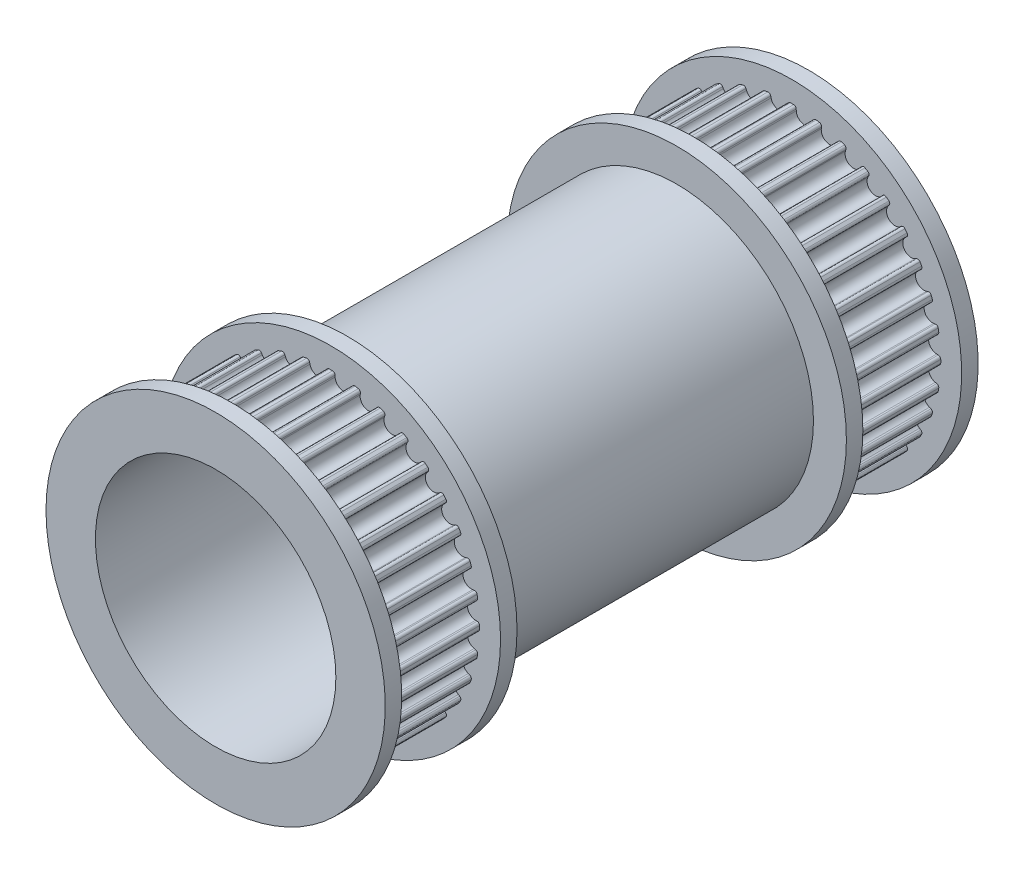
from build123d import *

# Parameters (mm, degrees)
SKETCH2_R             = 45.15
EXTRUDE1_DEPTH        = 30
EXTRUDE2_DEPTH        = 140
CIRPATTERN1_COUNT     = 36
SKETCH6_R             = 41.5
EXTRUDE6_DEPTH        = 110
MIRROR4_COPY_1_DEPTH  = 140
MIRROR4_COPY_2_DEPTH  = 140
MIRROR4_COPY_3_DEPTH  = 140
MIRROR4_COPY_4_DEPTH  = 140
MIRROR4_COPY_5_DEPTH  = 140
MIRROR4_COPY_6_DEPTH  = 140
MIRROR4_COPY_7_DEPTH  = 140
MIRROR4_COPY_8_DEPTH  = 140
MIRROR4_COPY_9_DEPTH  = 140
MIRROR4_COPY_10_DEPTH = 140
MIRROR4_COPY_11_DEPTH = 140
MIRROR4_COPY_12_DEPTH = 140
MIRROR4_COPY_13_DEPTH = 140
MIRROR4_COPY_14_DEPTH = 140
MIRROR4_COPY_15_DEPTH = 140
MIRROR4_COPY_16_DEPTH = 140
MIRROR4_COPY_17_DEPTH = 140
MIRROR4_COPY_18_DEPTH = 140
MIRROR4_COPY_19_DEPTH = 140
MIRROR4_COPY_20_DEPTH = 140
MIRROR4_COPY_21_DEPTH = 140
MIRROR4_COPY_22_DEPTH = 140
MIRROR4_COPY_23_DEPTH = 140
MIRROR4_COPY_24_DEPTH = 140
MIRROR4_COPY_25_DEPTH = 140
MIRROR4_COPY_26_DEPTH = 140
MIRROR4_COPY_27_DEPTH = 140
MIRROR4_COPY_28_DEPTH = 140
MIRROR4_COPY_29_DEPTH = 140
MIRROR4_COPY_30_DEPTH = 140
MIRROR4_COPY_31_DEPTH = 140
MIRROR4_COPY_32_DEPTH = 140
MIRROR4_COPY_33_DEPTH = 140
MIRROR4_COPY_34_DEPTH = 140
MIRROR4_COPY_35_DEPTH = 140
SKETCH7_R             = 51.5
SKETCH7_R_2           = 41.5
EXTRUDE7_DEPTH        = 5
EXTRUDE8_START        = 5
SKETCH8_R             = 51.5
EXTRUDE8_DEPTH        = 5
EXTRUDE9_DEPTH        = 116.777804436
EXTRUDE9_DEPTH_BACK   = 116.777804436
SKETCH9_R             = 36.5


with BuildPart() as part:
    # Sketch2 → Extrude1 (new body)
    with BuildSketch(Plane.XY):
        Circle(SKETCH2_R)
    extrude1 = extrude(amount=EXTRUDE1_DEPTH)

    # Sketch1 → Extrude2 (cut)
    with BuildSketch(Plane.XY):
        with BuildLine():
            Line((-1.265610805, 44.394558923), (-1.282106289, 43.922190055))
            ThreePointArc((-1.282106289, 43.922190055), (-3.626550456, 41.451661388), (-6.364380048, 43.477548716))
            Line((-6.364380048, 43.477548716), (-6.462650922, 43.939876828))
            ThreePointArc((-6.462650922, 43.939876828), (-6.785899963, 44.421956093), (-7.352628199, 44.547293504))
            ThreePointArc((-7.352628199, 44.547293504), (-3.935081785, 44.978190619), (-0.494631081, 45.147290507))
            ThreePointArc((-0.494631081, 45.147290507), (-1.030984829, 44.925445927), (-1.265610805, 44.394558923))
        make_face()
    extrude2 = extrude(amount=EXTRUDE2_DEPTH, mode=Mode.SUBTRACT)

    # CirPattern1: Extrude2 ×36 about axis
    cirpattern1_axis = Axis((0, 0, 0), (0, 0, 1))
    for i in range(1, CIRPATTERN1_COUNT):
        add(extrude2.rotate(cirpattern1_axis, i * 360 / CIRPATTERN1_COUNT), mode=Mode.SUBTRACT)

    # Sketch6 → Extrude6 (add)
    with BuildSketch(Plane.XY.offset(30)):
        Circle(SKETCH6_R)
    extrude(amount=EXTRUDE6_DEPTH)

    # Mirror4: Extrude1, Extrude2 across plane
    add(extrude1.mirror(Plane.XY.offset(85)))
    add(extrude2.mirror(Plane.XY.offset(85)), mode=Mode.SUBTRACT)

    # Mirror4 copy 1 sketch → Mirror4 copy 1 (cut)
    with BuildSketch(Plane(origin=(0, 0, 170), x_dir=(0.984807753012208, 0.17364817766693033, 0), z_dir=(0, 0, -1))):
        with BuildLine():
            Line((-1.265610805, -44.394558923), (-1.282106289, -43.922190055))
            ThreePointArc((-1.282106289, -43.922190055), (-3.626550456, -41.451661388), (-6.364380048, -43.477548716))
            Line((-6.364380048, -43.477548716), (-6.462650922, -43.939876828))
            ThreePointArc((-6.462650922, -43.939876828), (-6.785899963, -44.421956093), (-7.352628199, -44.547293504))
            ThreePointArc((-7.352628199, -44.547293504), (-3.935081785, -44.978190619), (-0.494631081, -45.147290507))
            ThreePointArc((-0.494631081, -45.147290507), (-1.030984829, -44.925445927), (-1.265610805, -44.394558923))
        make_face()
    extrude(amount=MIRROR4_COPY_1_DEPTH, mode=Mode.SUBTRACT)

    # Mirror4 copy 2 sketch → Mirror4 copy 2 (cut)
    with BuildSketch(Plane(origin=(0, 0, 170), x_dir=(0.9396926207859084, 0.3420201433256687, 0), z_dir=(0, 0, -1))):
        with BuildLine():
            Line((-1.265610805, -44.394558923), (-1.282106289, -43.922190055))
            ThreePointArc((-1.282106289, -43.922190055), (-3.626550456, -41.451661388), (-6.364380048, -43.477548716))
            Line((-6.364380048, -43.477548716), (-6.462650922, -43.939876828))
            ThreePointArc((-6.462650922, -43.939876828), (-6.785899963, -44.421956093), (-7.352628199, -44.547293504))
            ThreePointArc((-7.352628199, -44.547293504), (-3.935081785, -44.978190619), (-0.494631081, -45.147290507))
            ThreePointArc((-0.494631081, -45.147290507), (-1.030984829, -44.925445927), (-1.265610805, -44.394558923))
        make_face()
    extrude(amount=MIRROR4_COPY_2_DEPTH, mode=Mode.SUBTRACT)

    # Mirror4 copy 3 sketch → Mirror4 copy 3 (cut)
    with BuildSketch(Plane(origin=(0, 0, 170), x_dir=(0.8660254037844387, 0.49999999999999994, 0), z_dir=(0, 0, -1))):
        with BuildLine():
            Line((-1.265610805, -44.394558923), (-1.282106289, -43.922190055))
            ThreePointArc((-1.282106289, -43.922190055), (-3.626550456, -41.451661388), (-6.364380048, -43.477548716))
            Line((-6.364380048, -43.477548716), (-6.462650922, -43.939876828))
            ThreePointArc((-6.462650922, -43.939876828), (-6.785899963, -44.421956093), (-7.352628199, -44.547293504))
            ThreePointArc((-7.352628199, -44.547293504), (-3.935081785, -44.978190619), (-0.494631081, -45.147290507))
            ThreePointArc((-0.494631081, -45.147290507), (-1.030984829, -44.925445927), (-1.265610805, -44.394558923))
        make_face()
    extrude(amount=MIRROR4_COPY_3_DEPTH, mode=Mode.SUBTRACT)

    # Mirror4 copy 4 sketch → Mirror4 copy 4 (cut)
    with BuildSketch(Plane(origin=(0, 0, 170), x_dir=(0.766044443118978, 0.6427876096865393, 0), z_dir=(0, 0, -1))):
        with BuildLine():
            Line((-1.265610805, -44.394558923), (-1.282106289, -43.922190055))
            ThreePointArc((-1.282106289, -43.922190055), (-3.626550456, -41.451661388), (-6.364380048, -43.477548716))
            Line((-6.364380048, -43.477548716), (-6.462650922, -43.939876828))
            ThreePointArc((-6.462650922, -43.939876828), (-6.785899963, -44.421956093), (-7.352628199, -44.547293504))
            ThreePointArc((-7.352628199, -44.547293504), (-3.935081785, -44.978190619), (-0.494631081, -45.147290507))
            ThreePointArc((-0.494631081, -45.147290507), (-1.030984829, -44.925445927), (-1.265610805, -44.394558923))
        make_face()
    extrude(amount=MIRROR4_COPY_4_DEPTH, mode=Mode.SUBTRACT)

    # Mirror4 copy 5 sketch → Mirror4 copy 5 (cut)
    with BuildSketch(Plane(origin=(0, 0, 170), x_dir=(0.6427876096865394, 0.766044443118978, 0), z_dir=(0, 0, -1))):
        with BuildLine():
            Line((-1.265610805, -44.394558923), (-1.282106289, -43.922190055))
            ThreePointArc((-1.282106289, -43.922190055), (-3.626550456, -41.451661388), (-6.364380048, -43.477548716))
            Line((-6.364380048, -43.477548716), (-6.462650922, -43.939876828))
            ThreePointArc((-6.462650922, -43.939876828), (-6.785899963, -44.421956093), (-7.352628199, -44.547293504))
            ThreePointArc((-7.352628199, -44.547293504), (-3.935081785, -44.978190619), (-0.494631081, -45.147290507))
            ThreePointArc((-0.494631081, -45.147290507), (-1.030984829, -44.925445927), (-1.265610805, -44.394558923))
        make_face()
    extrude(amount=MIRROR4_COPY_5_DEPTH, mode=Mode.SUBTRACT)

    # Mirror4 copy 6 sketch → Mirror4 copy 6 (cut)
    with BuildSketch(Plane(origin=(0, 0, 170), x_dir=(0.5000000000000001, 0.8660254037844386, 0), z_dir=(0, 0, -1))):
        with BuildLine():
            Line((-1.265610805, -44.394558923), (-1.282106289, -43.922190055))
            ThreePointArc((-1.282106289, -43.922190055), (-3.626550456, -41.451661388), (-6.364380048, -43.477548716))
            Line((-6.364380048, -43.477548716), (-6.462650922, -43.939876828))
            ThreePointArc((-6.462650922, -43.939876828), (-6.785899963, -44.421956093), (-7.352628199, -44.547293504))
            ThreePointArc((-7.352628199, -44.547293504), (-3.935081785, -44.978190619), (-0.494631081, -45.147290507))
            ThreePointArc((-0.494631081, -45.147290507), (-1.030984829, -44.925445927), (-1.265610805, -44.394558923))
        make_face()
    extrude(amount=MIRROR4_COPY_6_DEPTH, mode=Mode.SUBTRACT)

    # Mirror4 copy 7 sketch → Mirror4 copy 7 (cut)
    with BuildSketch(Plane(origin=(0, 0, 170), x_dir=(0.3420201433256688, 0.9396926207859083, 0), z_dir=(0, 0, -1))):
        with BuildLine():
            Line((-1.265610805, -44.394558923), (-1.282106289, -43.922190055))
            ThreePointArc((-1.282106289, -43.922190055), (-3.626550456, -41.451661388), (-6.364380048, -43.477548716))
            Line((-6.364380048, -43.477548716), (-6.462650922, -43.939876828))
            ThreePointArc((-6.462650922, -43.939876828), (-6.785899963, -44.421956093), (-7.352628199, -44.547293504))
            ThreePointArc((-7.352628199, -44.547293504), (-3.935081785, -44.978190619), (-0.494631081, -45.147290507))
            ThreePointArc((-0.494631081, -45.147290507), (-1.030984829, -44.925445927), (-1.265610805, -44.394558923))
        make_face()
    extrude(amount=MIRROR4_COPY_7_DEPTH, mode=Mode.SUBTRACT)

    # Mirror4 copy 8 sketch → Mirror4 copy 8 (cut)
    with BuildSketch(Plane(origin=(0, 0, 170), x_dir=(0.17364817766693041, 0.984807753012208, 0), z_dir=(0, 0, -1))):
        with BuildLine():
            Line((-1.265610805, -44.394558923), (-1.282106289, -43.922190055))
            ThreePointArc((-1.282106289, -43.922190055), (-3.626550456, -41.451661388), (-6.364380048, -43.477548716))
            Line((-6.364380048, -43.477548716), (-6.462650922, -43.939876828))
            ThreePointArc((-6.462650922, -43.939876828), (-6.785899963, -44.421956093), (-7.352628199, -44.547293504))
            ThreePointArc((-7.352628199, -44.547293504), (-3.935081785, -44.978190619), (-0.494631081, -45.147290507))
            ThreePointArc((-0.494631081, -45.147290507), (-1.030984829, -44.925445927), (-1.265610805, -44.394558923))
        make_face()
    extrude(amount=MIRROR4_COPY_8_DEPTH, mode=Mode.SUBTRACT)

    # Mirror4 copy 9 sketch → Mirror4 copy 9 (cut)
    with BuildSketch(Plane.YX.offset(-170)):
        with BuildLine():
            Line((-1.265610805, -44.394558923), (-1.282106289, -43.922190055))
            ThreePointArc((-1.282106289, -43.922190055), (-3.626550456, -41.451661388), (-6.364380048, -43.477548716))
            Line((-6.364380048, -43.477548716), (-6.462650922, -43.939876828))
            ThreePointArc((-6.462650922, -43.939876828), (-6.785899963, -44.421956093), (-7.352628199, -44.547293504))
            ThreePointArc((-7.352628199, -44.547293504), (-3.935081785, -44.978190619), (-0.494631081, -45.147290507))
            ThreePointArc((-0.494631081, -45.147290507), (-1.030984829, -44.925445927), (-1.265610805, -44.394558923))
        make_face()
    extrude(amount=MIRROR4_COPY_9_DEPTH, mode=Mode.SUBTRACT)

    # Mirror4 copy 10 sketch → Mirror4 copy 10 (cut)
    with BuildSketch(Plane(origin=(0, 0, 170), x_dir=(-0.1736481776669303, 0.984807753012208, 0), z_dir=(0, 0, -1))):
        with BuildLine():
            Line((-1.265610805, -44.394558923), (-1.282106289, -43.922190055))
            ThreePointArc((-1.282106289, -43.922190055), (-3.626550456, -41.451661388), (-6.364380048, -43.477548716))
            Line((-6.364380048, -43.477548716), (-6.462650922, -43.939876828))
            ThreePointArc((-6.462650922, -43.939876828), (-6.785899963, -44.421956093), (-7.352628199, -44.547293504))
            ThreePointArc((-7.352628199, -44.547293504), (-3.935081785, -44.978190619), (-0.494631081, -45.147290507))
            ThreePointArc((-0.494631081, -45.147290507), (-1.030984829, -44.925445927), (-1.265610805, -44.394558923))
        make_face()
    extrude(amount=MIRROR4_COPY_10_DEPTH, mode=Mode.SUBTRACT)

    # Mirror4 copy 11 sketch → Mirror4 copy 11 (cut)
    with BuildSketch(Plane(origin=(0, 0, 170), x_dir=(-0.3420201433256687, 0.9396926207859084, 0), z_dir=(0, 0, -1))):
        with BuildLine():
            Line((-1.265610805, -44.394558923), (-1.282106289, -43.922190055))
            ThreePointArc((-1.282106289, -43.922190055), (-3.626550456, -41.451661388), (-6.364380048, -43.477548716))
            Line((-6.364380048, -43.477548716), (-6.462650922, -43.939876828))
            ThreePointArc((-6.462650922, -43.939876828), (-6.785899963, -44.421956093), (-7.352628199, -44.547293504))
            ThreePointArc((-7.352628199, -44.547293504), (-3.935081785, -44.978190619), (-0.494631081, -45.147290507))
            ThreePointArc((-0.494631081, -45.147290507), (-1.030984829, -44.925445927), (-1.265610805, -44.394558923))
        make_face()
    extrude(amount=MIRROR4_COPY_11_DEPTH, mode=Mode.SUBTRACT)

    # Mirror4 copy 12 sketch → Mirror4 copy 12 (cut)
    with BuildSketch(Plane(origin=(0, 0, 170), x_dir=(-0.4999999999999998, 0.8660254037844387, 0), z_dir=(0, 0, -1))):
        with BuildLine():
            Line((-1.265610805, -44.394558923), (-1.282106289, -43.922190055))
            ThreePointArc((-1.282106289, -43.922190055), (-3.626550456, -41.451661388), (-6.364380048, -43.477548716))
            Line((-6.364380048, -43.477548716), (-6.462650922, -43.939876828))
            ThreePointArc((-6.462650922, -43.939876828), (-6.785899963, -44.421956093), (-7.352628199, -44.547293504))
            ThreePointArc((-7.352628199, -44.547293504), (-3.935081785, -44.978190619), (-0.494631081, -45.147290507))
            ThreePointArc((-0.494631081, -45.147290507), (-1.030984829, -44.925445927), (-1.265610805, -44.394558923))
        make_face()
    extrude(amount=MIRROR4_COPY_12_DEPTH, mode=Mode.SUBTRACT)

    # Mirror4 copy 13 sketch → Mirror4 copy 13 (cut)
    with BuildSketch(Plane(origin=(0, 0, 170), x_dir=(-0.6427876096865394, 0.766044443118978, 0), z_dir=(0, 0, -1))):
        with BuildLine():
            Line((-1.265610805, -44.394558923), (-1.282106289, -43.922190055))
            ThreePointArc((-1.282106289, -43.922190055), (-3.626550456, -41.451661388), (-6.364380048, -43.477548716))
            Line((-6.364380048, -43.477548716), (-6.462650922, -43.939876828))
            ThreePointArc((-6.462650922, -43.939876828), (-6.785899963, -44.421956093), (-7.352628199, -44.547293504))
            ThreePointArc((-7.352628199, -44.547293504), (-3.935081785, -44.978190619), (-0.494631081, -45.147290507))
            ThreePointArc((-0.494631081, -45.147290507), (-1.030984829, -44.925445927), (-1.265610805, -44.394558923))
        make_face()
    extrude(amount=MIRROR4_COPY_13_DEPTH, mode=Mode.SUBTRACT)

    # Mirror4 copy 14 sketch → Mirror4 copy 14 (cut)
    with BuildSketch(Plane(origin=(0, 0, 170), x_dir=(-0.7660444431189779, 0.6427876096865395, 0), z_dir=(0, 0, -1))):
        with BuildLine():
            Line((-1.265610805, -44.394558923), (-1.282106289, -43.922190055))
            ThreePointArc((-1.282106289, -43.922190055), (-3.626550456, -41.451661388), (-6.364380048, -43.477548716))
            Line((-6.364380048, -43.477548716), (-6.462650922, -43.939876828))
            ThreePointArc((-6.462650922, -43.939876828), (-6.785899963, -44.421956093), (-7.352628199, -44.547293504))
            ThreePointArc((-7.352628199, -44.547293504), (-3.935081785, -44.978190619), (-0.494631081, -45.147290507))
            ThreePointArc((-0.494631081, -45.147290507), (-1.030984829, -44.925445927), (-1.265610805, -44.394558923))
        make_face()
    extrude(amount=MIRROR4_COPY_14_DEPTH, mode=Mode.SUBTRACT)

    # Mirror4 copy 15 sketch → Mirror4 copy 15 (cut)
    with BuildSketch(Plane(origin=(0, 0, 170), x_dir=(-0.8660254037844387, 0.49999999999999994, 0), z_dir=(0, 0, -1))):
        with BuildLine():
            Line((-1.265610805, -44.394558923), (-1.282106289, -43.922190055))
            ThreePointArc((-1.282106289, -43.922190055), (-3.626550456, -41.451661388), (-6.364380048, -43.477548716))
            Line((-6.364380048, -43.477548716), (-6.462650922, -43.939876828))
            ThreePointArc((-6.462650922, -43.939876828), (-6.785899963, -44.421956093), (-7.352628199, -44.547293504))
            ThreePointArc((-7.352628199, -44.547293504), (-3.935081785, -44.978190619), (-0.494631081, -45.147290507))
            ThreePointArc((-0.494631081, -45.147290507), (-1.030984829, -44.925445927), (-1.265610805, -44.394558923))
        make_face()
    extrude(amount=MIRROR4_COPY_15_DEPTH, mode=Mode.SUBTRACT)

    # Mirror4 copy 16 sketch → Mirror4 copy 16 (cut)
    with BuildSketch(Plane(origin=(0, 0, 170), x_dir=(-0.9396926207859083, 0.3420201433256689, 0), z_dir=(0, 0, -1))):
        with BuildLine():
            Line((-1.265610805, -44.394558923), (-1.282106289, -43.922190055))
            ThreePointArc((-1.282106289, -43.922190055), (-3.626550456, -41.451661388), (-6.364380048, -43.477548716))
            Line((-6.364380048, -43.477548716), (-6.462650922, -43.939876828))
            ThreePointArc((-6.462650922, -43.939876828), (-6.785899963, -44.421956093), (-7.352628199, -44.547293504))
            ThreePointArc((-7.352628199, -44.547293504), (-3.935081785, -44.978190619), (-0.494631081, -45.147290507))
            ThreePointArc((-0.494631081, -45.147290507), (-1.030984829, -44.925445927), (-1.265610805, -44.394558923))
        make_face()
    extrude(amount=MIRROR4_COPY_16_DEPTH, mode=Mode.SUBTRACT)

    # Mirror4 copy 17 sketch → Mirror4 copy 17 (cut)
    with BuildSketch(Plane(origin=(0, 0, 170), x_dir=(-0.984807753012208, 0.17364817766693028, 0), z_dir=(0, 0, -1))):
        with BuildLine():
            Line((-1.265610805, -44.394558923), (-1.282106289, -43.922190055))
            ThreePointArc((-1.282106289, -43.922190055), (-3.626550456, -41.451661388), (-6.364380048, -43.477548716))
            Line((-6.364380048, -43.477548716), (-6.462650922, -43.939876828))
            ThreePointArc((-6.462650922, -43.939876828), (-6.785899963, -44.421956093), (-7.352628199, -44.547293504))
            ThreePointArc((-7.352628199, -44.547293504), (-3.935081785, -44.978190619), (-0.494631081, -45.147290507))
            ThreePointArc((-0.494631081, -45.147290507), (-1.030984829, -44.925445927), (-1.265610805, -44.394558923))
        make_face()
    extrude(amount=MIRROR4_COPY_17_DEPTH, mode=Mode.SUBTRACT)

    # Mirror4 copy 18 sketch → Mirror4 copy 18 (cut)
    with BuildSketch(Plane(origin=(0, 0, 170), x_dir=(-1, 0, 0), z_dir=(0, 0, -1))):
        with BuildLine():
            Line((-1.265610805, -44.394558923), (-1.282106289, -43.922190055))
            ThreePointArc((-1.282106289, -43.922190055), (-3.626550456, -41.451661388), (-6.364380048, -43.477548716))
            Line((-6.364380048, -43.477548716), (-6.462650922, -43.939876828))
            ThreePointArc((-6.462650922, -43.939876828), (-6.785899963, -44.421956093), (-7.352628199, -44.547293504))
            ThreePointArc((-7.352628199, -44.547293504), (-3.935081785, -44.978190619), (-0.494631081, -45.147290507))
            ThreePointArc((-0.494631081, -45.147290507), (-1.030984829, -44.925445927), (-1.265610805, -44.394558923))
        make_face()
    extrude(amount=MIRROR4_COPY_18_DEPTH, mode=Mode.SUBTRACT)

    # Mirror4 copy 19 sketch → Mirror4 copy 19 (cut)
    with BuildSketch(Plane(origin=(0, 0, 170), x_dir=(-0.984807753012208, -0.17364817766693047, 0), z_dir=(0, 0, -1))):
        with BuildLine():
            Line((-1.265610805, -44.394558923), (-1.282106289, -43.922190055))
            ThreePointArc((-1.282106289, -43.922190055), (-3.626550456, -41.451661388), (-6.364380048, -43.477548716))
            Line((-6.364380048, -43.477548716), (-6.462650922, -43.939876828))
            ThreePointArc((-6.462650922, -43.939876828), (-6.785899963, -44.421956093), (-7.352628199, -44.547293504))
            ThreePointArc((-7.352628199, -44.547293504), (-3.935081785, -44.978190619), (-0.494631081, -45.147290507))
            ThreePointArc((-0.494631081, -45.147290507), (-1.030984829, -44.925445927), (-1.265610805, -44.394558923))
        make_face()
    extrude(amount=MIRROR4_COPY_19_DEPTH, mode=Mode.SUBTRACT)

    # Mirror4 copy 20 sketch → Mirror4 copy 20 (cut)
    with BuildSketch(Plane(origin=(0, 0, 170), x_dir=(-0.9396926207859084, -0.34202014332566866, 0), z_dir=(0, 0, -1))):
        with BuildLine():
            Line((-1.265610805, -44.394558923), (-1.282106289, -43.922190055))
            ThreePointArc((-1.282106289, -43.922190055), (-3.626550456, -41.451661388), (-6.364380048, -43.477548716))
            Line((-6.364380048, -43.477548716), (-6.462650922, -43.939876828))
            ThreePointArc((-6.462650922, -43.939876828), (-6.785899963, -44.421956093), (-7.352628199, -44.547293504))
            ThreePointArc((-7.352628199, -44.547293504), (-3.935081785, -44.978190619), (-0.494631081, -45.147290507))
            ThreePointArc((-0.494631081, -45.147290507), (-1.030984829, -44.925445927), (-1.265610805, -44.394558923))
        make_face()
    extrude(amount=MIRROR4_COPY_20_DEPTH, mode=Mode.SUBTRACT)

    # Mirror4 copy 21 sketch → Mirror4 copy 21 (cut)
    with BuildSketch(Plane(origin=(0, 0, 170), x_dir=(-0.8660254037844386, -0.5000000000000001, 0), z_dir=(0, 0, -1))):
        with BuildLine():
            Line((-1.265610805, -44.394558923), (-1.282106289, -43.922190055))
            ThreePointArc((-1.282106289, -43.922190055), (-3.626550456, -41.451661388), (-6.364380048, -43.477548716))
            Line((-6.364380048, -43.477548716), (-6.462650922, -43.939876828))
            ThreePointArc((-6.462650922, -43.939876828), (-6.785899963, -44.421956093), (-7.352628199, -44.547293504))
            ThreePointArc((-7.352628199, -44.547293504), (-3.935081785, -44.978190619), (-0.494631081, -45.147290507))
            ThreePointArc((-0.494631081, -45.147290507), (-1.030984829, -44.925445927), (-1.265610805, -44.394558923))
        make_face()
    extrude(amount=MIRROR4_COPY_21_DEPTH, mode=Mode.SUBTRACT)

    # Mirror4 copy 22 sketch → Mirror4 copy 22 (cut)
    with BuildSketch(Plane(origin=(0, 0, 170), x_dir=(-0.766044443118978, -0.6427876096865393, 0), z_dir=(0, 0, -1))):
        with BuildLine():
            Line((-1.265610805, -44.394558923), (-1.282106289, -43.922190055))
            ThreePointArc((-1.282106289, -43.922190055), (-3.626550456, -41.451661388), (-6.364380048, -43.477548716))
            Line((-6.364380048, -43.477548716), (-6.462650922, -43.939876828))
            ThreePointArc((-6.462650922, -43.939876828), (-6.785899963, -44.421956093), (-7.352628199, -44.547293504))
            ThreePointArc((-7.352628199, -44.547293504), (-3.935081785, -44.978190619), (-0.494631081, -45.147290507))
            ThreePointArc((-0.494631081, -45.147290507), (-1.030984829, -44.925445927), (-1.265610805, -44.394558923))
        make_face()
    extrude(amount=MIRROR4_COPY_22_DEPTH, mode=Mode.SUBTRACT)

    # Mirror4 copy 23 sketch → Mirror4 copy 23 (cut)
    with BuildSketch(Plane(origin=(0, 0, 170), x_dir=(-0.6427876096865395, -0.7660444431189779, 0), z_dir=(0, 0, -1))):
        with BuildLine():
            Line((-1.265610805, -44.394558923), (-1.282106289, -43.922190055))
            ThreePointArc((-1.282106289, -43.922190055), (-3.626550456, -41.451661388), (-6.364380048, -43.477548716))
            Line((-6.364380048, -43.477548716), (-6.462650922, -43.939876828))
            ThreePointArc((-6.462650922, -43.939876828), (-6.785899963, -44.421956093), (-7.352628199, -44.547293504))
            ThreePointArc((-7.352628199, -44.547293504), (-3.935081785, -44.978190619), (-0.494631081, -45.147290507))
            ThreePointArc((-0.494631081, -45.147290507), (-1.030984829, -44.925445927), (-1.265610805, -44.394558923))
        make_face()
    extrude(amount=MIRROR4_COPY_23_DEPTH, mode=Mode.SUBTRACT)

    # Mirror4 copy 24 sketch → Mirror4 copy 24 (cut)
    with BuildSketch(Plane(origin=(0, 0, 170), x_dir=(-0.5000000000000004, -0.8660254037844384, 0), z_dir=(0, 0, -1))):
        with BuildLine():
            Line((-1.265610805, -44.394558923), (-1.282106289, -43.922190055))
            ThreePointArc((-1.282106289, -43.922190055), (-3.626550456, -41.451661388), (-6.364380048, -43.477548716))
            Line((-6.364380048, -43.477548716), (-6.462650922, -43.939876828))
            ThreePointArc((-6.462650922, -43.939876828), (-6.785899963, -44.421956093), (-7.352628199, -44.547293504))
            ThreePointArc((-7.352628199, -44.547293504), (-3.935081785, -44.978190619), (-0.494631081, -45.147290507))
            ThreePointArc((-0.494631081, -45.147290507), (-1.030984829, -44.925445927), (-1.265610805, -44.394558923))
        make_face()
    extrude(amount=MIRROR4_COPY_24_DEPTH, mode=Mode.SUBTRACT)

    # Mirror4 copy 25 sketch → Mirror4 copy 25 (cut)
    with BuildSketch(Plane(origin=(0, 0, 170), x_dir=(-0.34202014332566855, -0.9396926207859084, 0), z_dir=(0, 0, -1))):
        with BuildLine():
            Line((-1.265610805, -44.394558923), (-1.282106289, -43.922190055))
            ThreePointArc((-1.282106289, -43.922190055), (-3.626550456, -41.451661388), (-6.364380048, -43.477548716))
            Line((-6.364380048, -43.477548716), (-6.462650922, -43.939876828))
            ThreePointArc((-6.462650922, -43.939876828), (-6.785899963, -44.421956093), (-7.352628199, -44.547293504))
            ThreePointArc((-7.352628199, -44.547293504), (-3.935081785, -44.978190619), (-0.494631081, -45.147290507))
            ThreePointArc((-0.494631081, -45.147290507), (-1.030984829, -44.925445927), (-1.265610805, -44.394558923))
        make_face()
    extrude(amount=MIRROR4_COPY_25_DEPTH, mode=Mode.SUBTRACT)

    # Mirror4 copy 26 sketch → Mirror4 copy 26 (cut)
    with BuildSketch(Plane(origin=(0, 0, 170), x_dir=(-0.17364817766693033, -0.984807753012208, 0), z_dir=(0, 0, -1))):
        with BuildLine():
            Line((-1.265610805, -44.394558923), (-1.282106289, -43.922190055))
            ThreePointArc((-1.282106289, -43.922190055), (-3.626550456, -41.451661388), (-6.364380048, -43.477548716))
            Line((-6.364380048, -43.477548716), (-6.462650922, -43.939876828))
            ThreePointArc((-6.462650922, -43.939876828), (-6.785899963, -44.421956093), (-7.352628199, -44.547293504))
            ThreePointArc((-7.352628199, -44.547293504), (-3.935081785, -44.978190619), (-0.494631081, -45.147290507))
            ThreePointArc((-0.494631081, -45.147290507), (-1.030984829, -44.925445927), (-1.265610805, -44.394558923))
        make_face()
    extrude(amount=MIRROR4_COPY_26_DEPTH, mode=Mode.SUBTRACT)

    # Mirror4 copy 27 sketch → Mirror4 copy 27 (cut)
    with BuildSketch(Plane(origin=(0, 0, 170), x_dir=(0, -1, 0), z_dir=(0, 0, -1))):
        with BuildLine():
            Line((-1.265610805, -44.394558923), (-1.282106289, -43.922190055))
            ThreePointArc((-1.282106289, -43.922190055), (-3.626550456, -41.451661388), (-6.364380048, -43.477548716))
            Line((-6.364380048, -43.477548716), (-6.462650922, -43.939876828))
            ThreePointArc((-6.462650922, -43.939876828), (-6.785899963, -44.421956093), (-7.352628199, -44.547293504))
            ThreePointArc((-7.352628199, -44.547293504), (-3.935081785, -44.978190619), (-0.494631081, -45.147290507))
            ThreePointArc((-0.494631081, -45.147290507), (-1.030984829, -44.925445927), (-1.265610805, -44.394558923))
        make_face()
    extrude(amount=MIRROR4_COPY_27_DEPTH, mode=Mode.SUBTRACT)

    # Mirror4 copy 28 sketch → Mirror4 copy 28 (cut)
    with BuildSketch(Plane(origin=(0, 0, 170), x_dir=(0.17364817766692997, -0.9848077530122081, 0), z_dir=(0, 0, -1))):
        with BuildLine():
            Line((-1.265610805, -44.394558923), (-1.282106289, -43.922190055))
            ThreePointArc((-1.282106289, -43.922190055), (-3.626550456, -41.451661388), (-6.364380048, -43.477548716))
            Line((-6.364380048, -43.477548716), (-6.462650922, -43.939876828))
            ThreePointArc((-6.462650922, -43.939876828), (-6.785899963, -44.421956093), (-7.352628199, -44.547293504))
            ThreePointArc((-7.352628199, -44.547293504), (-3.935081785, -44.978190619), (-0.494631081, -45.147290507))
            ThreePointArc((-0.494631081, -45.147290507), (-1.030984829, -44.925445927), (-1.265610805, -44.394558923))
        make_face()
    extrude(amount=MIRROR4_COPY_28_DEPTH, mode=Mode.SUBTRACT)

    # Mirror4 copy 29 sketch → Mirror4 copy 29 (cut)
    with BuildSketch(Plane(origin=(0, 0, 170), x_dir=(0.342020143325669, -0.9396926207859083, 0), z_dir=(0, 0, -1))):
        with BuildLine():
            Line((-1.265610805, -44.394558923), (-1.282106289, -43.922190055))
            ThreePointArc((-1.282106289, -43.922190055), (-3.626550456, -41.451661388), (-6.364380048, -43.477548716))
            Line((-6.364380048, -43.477548716), (-6.462650922, -43.939876828))
            ThreePointArc((-6.462650922, -43.939876828), (-6.785899963, -44.421956093), (-7.352628199, -44.547293504))
            ThreePointArc((-7.352628199, -44.547293504), (-3.935081785, -44.978190619), (-0.494631081, -45.147290507))
            ThreePointArc((-0.494631081, -45.147290507), (-1.030984829, -44.925445927), (-1.265610805, -44.394558923))
        make_face()
    extrude(amount=MIRROR4_COPY_29_DEPTH, mode=Mode.SUBTRACT)

    # Mirror4 copy 30 sketch → Mirror4 copy 30 (cut)
    with BuildSketch(Plane(origin=(0, 0, 170), x_dir=(0.5000000000000001, -0.8660254037844386, 0), z_dir=(0, 0, -1))):
        with BuildLine():
            Line((-1.265610805, -44.394558923), (-1.282106289, -43.922190055))
            ThreePointArc((-1.282106289, -43.922190055), (-3.626550456, -41.451661388), (-6.364380048, -43.477548716))
            Line((-6.364380048, -43.477548716), (-6.462650922, -43.939876828))
            ThreePointArc((-6.462650922, -43.939876828), (-6.785899963, -44.421956093), (-7.352628199, -44.547293504))
            ThreePointArc((-7.352628199, -44.547293504), (-3.935081785, -44.978190619), (-0.494631081, -45.147290507))
            ThreePointArc((-0.494631081, -45.147290507), (-1.030984829, -44.925445927), (-1.265610805, -44.394558923))
        make_face()
    extrude(amount=MIRROR4_COPY_30_DEPTH, mode=Mode.SUBTRACT)

    # Mirror4 copy 31 sketch → Mirror4 copy 31 (cut)
    with BuildSketch(Plane(origin=(0, 0, 170), x_dir=(0.6427876096865393, -0.7660444431189781, 0), z_dir=(0, 0, -1))):
        with BuildLine():
            Line((-1.265610805, -44.394558923), (-1.282106289, -43.922190055))
            ThreePointArc((-1.282106289, -43.922190055), (-3.626550456, -41.451661388), (-6.364380048, -43.477548716))
            Line((-6.364380048, -43.477548716), (-6.462650922, -43.939876828))
            ThreePointArc((-6.462650922, -43.939876828), (-6.785899963, -44.421956093), (-7.352628199, -44.547293504))
            ThreePointArc((-7.352628199, -44.547293504), (-3.935081785, -44.978190619), (-0.494631081, -45.147290507))
            ThreePointArc((-0.494631081, -45.147290507), (-1.030984829, -44.925445927), (-1.265610805, -44.394558923))
        make_face()
    extrude(amount=MIRROR4_COPY_31_DEPTH, mode=Mode.SUBTRACT)

    # Mirror4 copy 32 sketch → Mirror4 copy 32 (cut)
    with BuildSketch(Plane(origin=(0, 0, 170), x_dir=(0.7660444431189778, -0.6427876096865396, 0), z_dir=(0, 0, -1))):
        with BuildLine():
            Line((-1.265610805, -44.394558923), (-1.282106289, -43.922190055))
            ThreePointArc((-1.282106289, -43.922190055), (-3.626550456, -41.451661388), (-6.364380048, -43.477548716))
            Line((-6.364380048, -43.477548716), (-6.462650922, -43.939876828))
            ThreePointArc((-6.462650922, -43.939876828), (-6.785899963, -44.421956093), (-7.352628199, -44.547293504))
            ThreePointArc((-7.352628199, -44.547293504), (-3.935081785, -44.978190619), (-0.494631081, -45.147290507))
            ThreePointArc((-0.494631081, -45.147290507), (-1.030984829, -44.925445927), (-1.265610805, -44.394558923))
        make_face()
    extrude(amount=MIRROR4_COPY_32_DEPTH, mode=Mode.SUBTRACT)

    # Mirror4 copy 33 sketch → Mirror4 copy 33 (cut)
    with BuildSketch(Plane(origin=(0, 0, 170), x_dir=(0.8660254037844384, -0.5000000000000004, 0), z_dir=(0, 0, -1))):
        with BuildLine():
            Line((-1.265610805, -44.394558923), (-1.282106289, -43.922190055))
            ThreePointArc((-1.282106289, -43.922190055), (-3.626550456, -41.451661388), (-6.364380048, -43.477548716))
            Line((-6.364380048, -43.477548716), (-6.462650922, -43.939876828))
            ThreePointArc((-6.462650922, -43.939876828), (-6.785899963, -44.421956093), (-7.352628199, -44.547293504))
            ThreePointArc((-7.352628199, -44.547293504), (-3.935081785, -44.978190619), (-0.494631081, -45.147290507))
            ThreePointArc((-0.494631081, -45.147290507), (-1.030984829, -44.925445927), (-1.265610805, -44.394558923))
        make_face()
    extrude(amount=MIRROR4_COPY_33_DEPTH, mode=Mode.SUBTRACT)

    # Mirror4 copy 34 sketch → Mirror4 copy 34 (cut)
    with BuildSketch(Plane(origin=(0, 0, 170), x_dir=(0.9396926207859084, -0.3420201433256686, 0), z_dir=(0, 0, -1))):
        with BuildLine():
            Line((-1.265610805, -44.394558923), (-1.282106289, -43.922190055))
            ThreePointArc((-1.282106289, -43.922190055), (-3.626550456, -41.451661388), (-6.364380048, -43.477548716))
            Line((-6.364380048, -43.477548716), (-6.462650922, -43.939876828))
            ThreePointArc((-6.462650922, -43.939876828), (-6.785899963, -44.421956093), (-7.352628199, -44.547293504))
            ThreePointArc((-7.352628199, -44.547293504), (-3.935081785, -44.978190619), (-0.494631081, -45.147290507))
            ThreePointArc((-0.494631081, -45.147290507), (-1.030984829, -44.925445927), (-1.265610805, -44.394558923))
        make_face()
    extrude(amount=MIRROR4_COPY_34_DEPTH, mode=Mode.SUBTRACT)

    # Mirror4 copy 35 sketch → Mirror4 copy 35 (cut)
    with BuildSketch(Plane(origin=(0, 0, 170), x_dir=(0.984807753012208, -0.1736481776669304, 0), z_dir=(0, 0, -1))):
        with BuildLine():
            Line((-1.265610805, -44.394558923), (-1.282106289, -43.922190055))
            ThreePointArc((-1.282106289, -43.922190055), (-3.626550456, -41.451661388), (-6.364380048, -43.477548716))
            Line((-6.364380048, -43.477548716), (-6.462650922, -43.939876828))
            ThreePointArc((-6.462650922, -43.939876828), (-6.785899963, -44.421956093), (-7.352628199, -44.547293504))
            ThreePointArc((-7.352628199, -44.547293504), (-3.935081785, -44.978190619), (-0.494631081, -45.147290507))
            ThreePointArc((-0.494631081, -45.147290507), (-1.030984829, -44.925445927), (-1.265610805, -44.394558923))
        make_face()
    extrude(amount=MIRROR4_COPY_35_DEPTH, mode=Mode.SUBTRACT)

    # Sketch7 → Extrude7 (add)
    with BuildSketch(Plane.XY.offset(30)):
        Circle(SKETCH7_R)
        Circle(SKETCH7_R_2, mode=Mode.SUBTRACT)
    extrude7 = extrude(amount=EXTRUDE7_DEPTH)

    # Sketch8 → Extrude8 (add)
    with BuildSketch(Plane(origin=(0, 0, 0), x_dir=(-1, 0, 0), z_dir=(0, 0, -1)).offset(EXTRUDE8_START)):
        with Locations(Location((0, 0, 0), (0, 0, 180))):
            Circle(SKETCH8_R)
    extrude8 = extrude(amount=-EXTRUDE8_DEPTH)

    # Mirror5: Extrude7, Extrude8 across plane
    add(extrude7.mirror(Plane.XY.offset(85)))
    add(extrude8.mirror(Plane.XY.offset(85)))

    # Sketch9 → Extrude9 (cut, two sides: drawn at the far end of the back side and taken through both)
    with BuildSketch(Plane.XY.offset(85).offset(-EXTRUDE9_DEPTH_BACK)):
        Circle(SKETCH9_R)
    extrude(amount=EXTRUDE9_DEPTH + EXTRUDE9_DEPTH_BACK, mode=Mode.SUBTRACT)


solid = part.part
